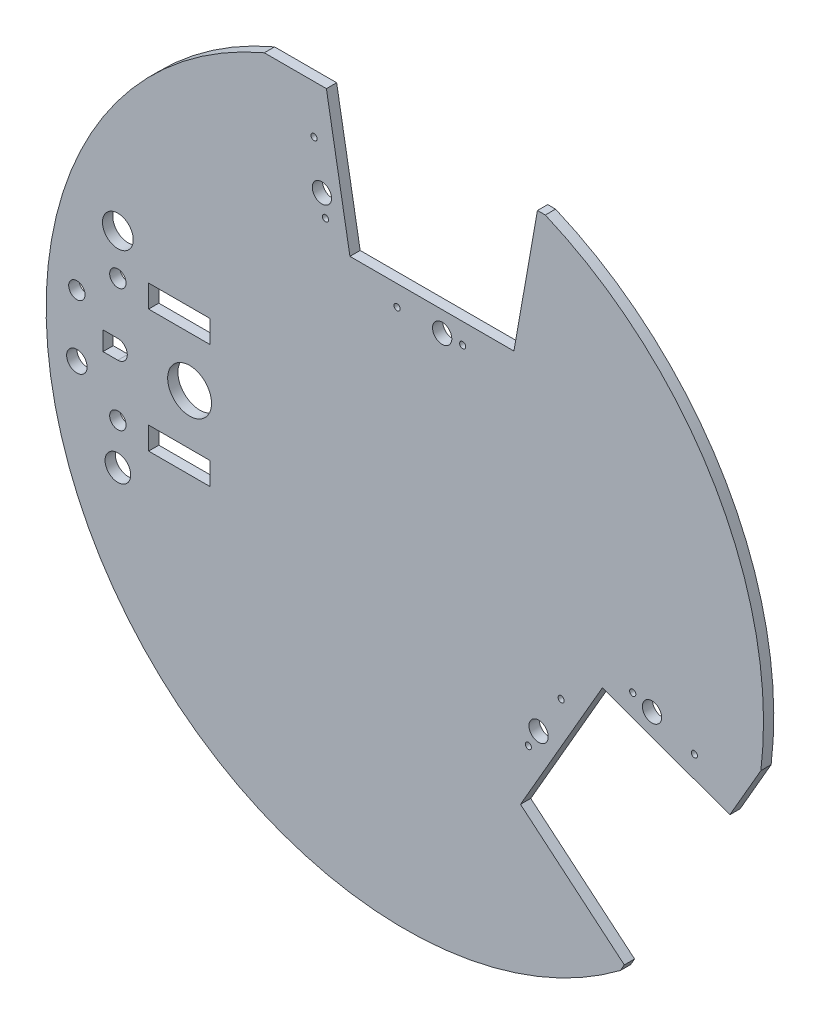
from build123d import *

# Parameters (mm, degrees)
ESQUISSE1_R             = 175
BOSS_EXTRU_1_DEPTH      = 5
ESQUISSE2_R             = 4.7
ENL_V_MAT_EXTRU_1_DEPTH = 5
LEDS_BOUT_TIRETTE_R     = 10.7
LEDS_BOUT_TIRETTE_R_2   = 6.25
LEDS_BOUT_TIRETTE_R_3   = 4
LEDS_BOUT_TIRETTE_R_4   = 5
LEDS_BOUT_TIRETTE_R_5   = 7.5
LEDS_BOUT_TIRETTE_W     = 30
LEDS_BOUT_TIRETTE_H     = 11
LEDS_BUTTONS_DEPTH      = 10
FIXATION_ACENSSEURS_R   = 1.5
ENL_V_MAT_EXTRU_2_DEPTH = 10


with BuildPart() as part:
    # Esquisse1 → Boss.-Extru.1 (new body)
    with BuildSketch(Plane.XY):
        Circle(ESQUISSE1_R)
    extrude(amount=BOSS_EXTRU_1_DEPTH)

    # Esquisse2 → Enlèv. mat.-Extru.1 (cut)
    with BuildSketch(Plane(origin=(0, 0, 0), x_dir=(-1, 0, 0), z_dir=(0, 0, -1))):
        with Locations((-18.220426897, 85.887612711)):
            Circle(ESQUISSE2_R)
        with Locations((40.460378836, 115.887612711)):
            Circle(ESQUISSE2_R)
        with Locations((-65.270641029, -58.723158916)):
            Circle(ESQUISSE2_R)
        with Locations((-120.59180601, -22.904090436)):
            Circle(ESQUISSE2_R)
        Polygon((26.7795731, 95.88761271), (38.263317053, 161.015161015), (68.550112498, 161.015161015), (68.550112498, 190.246123658), (-94.990966298, 190.246123658), (-94.990966298, 161.015161015), (-64.704170853, 161.015161015), (-53.2204269, 95.88761271), align=None)
        Polygon((-96.430895065, -24.752015748), (-158.57487836, -47.370575906), (-173.718276082, -21.141441652), (-199.033032308, -35.756922974), (-117.262492911, -177.387651773), (-91.947736684, -162.772170451), (-107.091134406, -136.543036197), (-56.430895065, -94.034048051), align=None)
    extrude(amount=-ENL_V_MAT_EXTRU_1_DEPTH, mode=Mode.SUBTRACT)

    # Leds, bout., tirette → Leds, buttons (cut)
    with BuildSketch(Plane.XY.offset(5)):
        with Locations((-105, 0)):
            Circle(LEDS_BOUT_TIRETTE_R)
        with Locations((-140, -50)):
            Circle(LEDS_BOUT_TIRETTE_R_2)
        with Locations((-140, 30)):
            Circle(LEDS_BOUT_TIRETTE_R_3)
        with Locations((-140, -30)):
            Circle(LEDS_BOUT_TIRETTE_R_3)
        with Locations((-160, 15)):
            Circle(LEDS_BOUT_TIRETTE_R_3)
        with Locations((-160, -15)):
            Circle(LEDS_BOUT_TIRETTE_R_4)
        with Locations((-140, 50)):
            Circle(LEDS_BOUT_TIRETTE_R_5)
        with BuildLine():
            Line((-140, -4.6), (-147.25, -4.6))
            Line((-147.25, -4.6), (-147.25, 4.6))
            Line((-147.25, 4.6), (-140, 4.6))
            ThreePointArc((-140, 4.6), (-135.4, 0), (-140, -4.6))
        make_face()
        with Locations((-110, 30)):
            Rectangle(LEDS_BOUT_TIRETTE_W, LEDS_BOUT_TIRETTE_H)
        with Locations((-110, -30)):
            Rectangle(LEDS_BOUT_TIRETTE_W, LEDS_BOUT_TIRETTE_H)
    extrude(amount=-LEDS_BUTTONS_DEPTH, mode=Mode.SUBTRACT)

    # Fixation acensseurs → Enlèv. mat.-Extru.2 (cut)
    with BuildSketch(Plane(origin=(0, 0, 0), x_dir=(-1, 0, 0), z_dir=(0, 0, -1))):
        with Locations((38.72389706, 106.03953518)):
            Circle(FIXATION_ACENSSEURS_R)
        with Locations((-28.220426897, 85.887612711)):
            Circle(FIXATION_ACENSSEURS_R)
        with Locations((44.280638745, 137.553383277)):
            Circle(FIXATION_ACENSSEURS_R)
        with Locations((3.779573103, 85.887612711)):
            Circle(FIXATION_ACENSSEURS_R)
        with Locations((-111.194879802, -19.483889003)):
            Circle(FIXATION_ACENSSEURS_R)
        with Locations((-60.270641029, -67.383412953)):
            Circle(FIXATION_ACENSSEURS_R)
        with Locations((-141.265043667, -30.428533589)):
            Circle(FIXATION_ACENSSEURS_R)
        with Locations((-76.270641029, -39.670600032)):
            Circle(FIXATION_ACENSSEURS_R)
    extrude(amount=-ENL_V_MAT_EXTRU_2_DEPTH, mode=Mode.SUBTRACT)


solid = part.part
